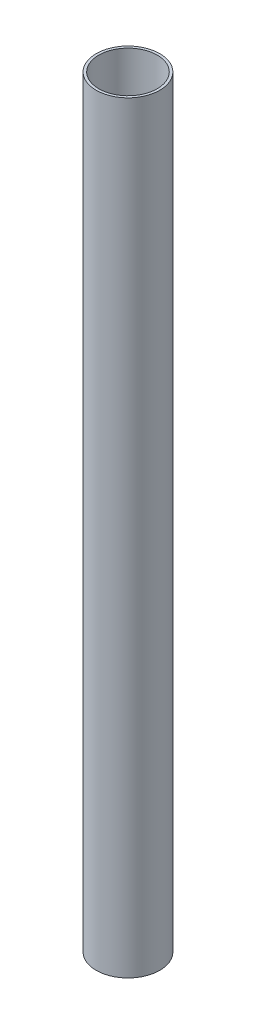
from build123d import *

# Parameters (mm, degrees)
SKETCH1_R           = 1.25
BOSS_EXTRUDE1_DEPTH = 30
SKETCH2_R           = 1.15
CUT_EXTRUDE1_DEPTH  = 31.0520382


with BuildPart() as part:
    # Sketch1 → Boss-Extrude1 (new body)
    with BuildSketch(Plane(origin=(0, 0, 0), x_dir=(1, 0, 0), z_dir=(0, 1, 0))):
        Circle(SKETCH1_R)
    extrude(amount=BOSS_EXTRUDE1_DEPTH)

    # Sketch2 → Cut-Extrude1 (cut, through all)
    with BuildSketch(Plane(origin=(0, 30, 0), x_dir=(1, 0, 0), z_dir=(0, 1, 0))):
        Circle(SKETCH2_R)
    extrude(amount=-CUT_EXTRUDE1_DEPTH, mode=Mode.SUBTRACT)


solid = part.part
